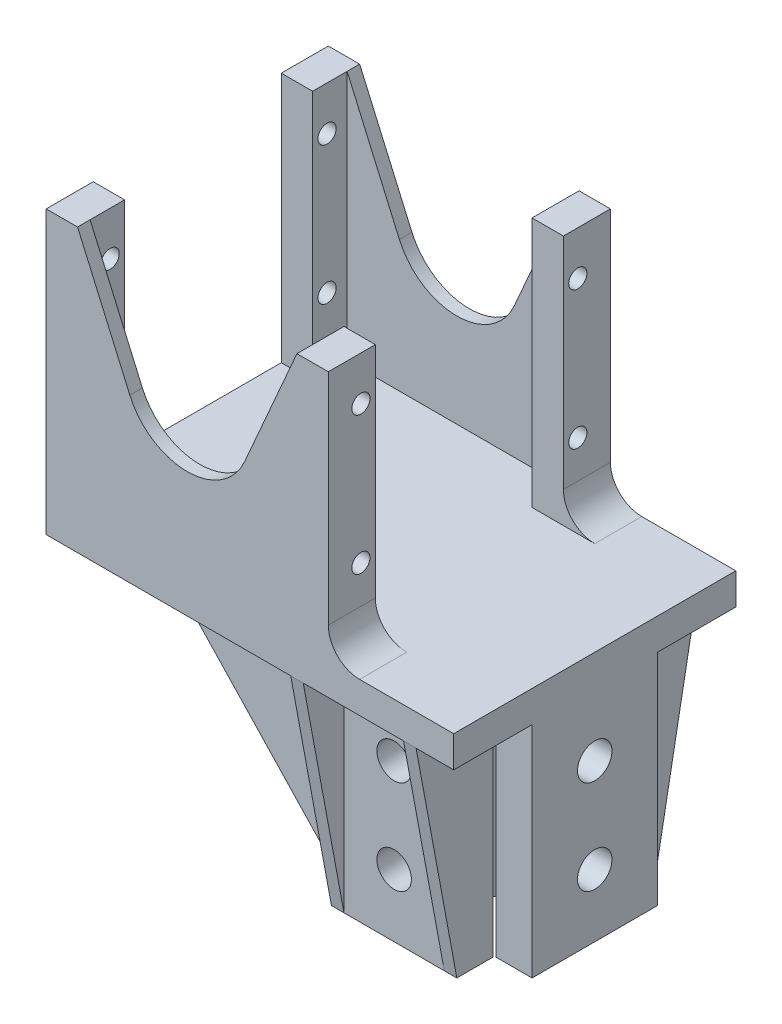
from build123d import *

# Parameters (mm, degrees)
BOSS_EXTRUDE1_DEPTH           = 45
SKETCH3_W                     = 30
SKETCH3_H                     = 40
CUT_EXTRUDE1_DEPTH            = 83.196411114
SKETCH4_W                     = 32
SKETCH4_H                     = 32
SKETCH4_W_2                   = 20.5
SKETCH4_H_2                   = 20.5
SKETCH4_R                     = 2.5
BOSS_EXTRUDE2_DEPTH           = 35
SKETCH6_W                     = 6
SKETCH6_H                     = 6
CUT_EXTRUDE4_DEPTH            = 35
RIB1_REACH                    = 84.092
SKETCH9_WALL_W                = 214.287640152
SKETCH9_WALL_H                = 2
LPATTERN1_COUNT               = 2
LPATTERN1_PITCH               = 18
RIB6_REACH                    = 95.874
SKETCH14_WALL_W               = 225.34562544
SKETCH14_WALL_H               = 2
RIB7_START                    = -2
RIB7_DEPTH                    = 2
CIRPATTERN3_START             = -9.75
CIRPATTERN3_DEPTH             = 2
CIRPATTERN3_START_2           = 8.25
CIRPATTERN3_2_DEPTH           = 2
FILLET2_R                     = 5
FILLET3_R                     = 5
RIB10_REACH                   = 89.794
SKETCH17_WALL_W               = 221.248919868
SKETCH17_WALL_H               = 2
RIB11_REACH                   = 89.794
SKETCH18_WALL_W               = 221.248919868
SKETCH18_WALL_H               = 2
FILLET4_R                     = 10
LPATTERN2_COUNT               = 2
LPATTERN2_PITCH               = 43
FILLET4_OF_LPATTERN2_R        = 10
M5_CLEARANCE_HOLE2_AT_2_COUNT = 2
M5_CLEARANCE_HOLE2_AT_2_PITCH = 15
CIRPATTERN4_START             = 6.5
CIRPATTERN4_OUTLINE_R         = 2.75
CIRPATTERN4_DEPTH             = 5.75
CIRPATTERN4_START_2           = -15.75
CIRPATTERN4_2_OUTLINE_R       = 2.75
CIRPATTERN4_2_DEPTH           = 5.75
CIRPATTERN4_START_3           = 10.5
CIRPATTERN4_3_OUTLINE_R       = 2.75
CIRPATTERN4_3_DEPTH           = 5.75
M2_5_CLEARANCE_HOLE1_D        = 2.9


# Read off the part's stored shape, not the designer's step: Rib7, CirPattern3, CirPattern4
with BuildPart() as part:
    # Sketch2 → Boss-Extrude1 (new body)
    with BuildSketch(Plane.XY):
        Polygon((-48.75, -22.5), (16.25, -22.5), (16.25, -17.5), (-3.75, -17.5), (-3.75, 22.5), (-8.75, 22.5), (-8.75, -17.5), (-43.75, -17.5), (-43.75, 22.5), (-48.75, 22.5), align=None)
    extrude(amount=BOSS_EXTRUDE1_DEPTH)

    # Sketch3 → Cut-Extrude1 (cut, through all)
    with BuildSketch(Plane(origin=(-48.75, 0, 0), x_dir=(0, 0, -1), z_dir=(1, 0, 0))):
        with Locations((-22.5, 2.5)):
            Rectangle(SKETCH3_W, SKETCH3_H)
    extrude(amount=CUT_EXTRUDE1_DEPTH, mode=Mode.SUBTRACT)

    # Sketch4 → Boss-Extrude2 (add)
    # profile 1 of 2: a face of its own
    with BuildSketch(Plane.XZ.offset(22.5)):
        with Locations((0.25, 22.5)):
            Rectangle(SKETCH4_W, SKETCH4_H)
        with Locations((0.25, 22.5)):
            Rectangle(SKETCH4_W_2, SKETCH4_H_2, mode=Mode.SUBTRACT)
    # profile 2 of 2: a face of its own
    with BuildSketch(Plane.XZ.offset(22.5)):
        with Locations(Location((0.25, 22.5, 0), (0, 0, 180))):
            Circle(SKETCH4_R)
    extrude(amount=BOSS_EXTRUDE2_DEPTH)

    # Sketch6 → Cut-Extrude4 (cut)
    with BuildSketch(Plane(origin=(0, -57.5, 0), x_dir=(-1, 0, 0), z_dir=(0, -1, 0))):
        with Locations((12.75, -35.5)):
            Rectangle(SKETCH6_W, SKETCH6_H)
        with Locations((-13.25, -35.5)):
            Rectangle(SKETCH6_W, SKETCH6_H)
        with Locations((-13.25, -9.5)):
            Rectangle(SKETCH6_W, SKETCH6_H)
        with Locations((12.75, -9.5)):
            Rectangle(SKETCH6_W, SKETCH6_H)
    extrude(amount=-CUT_EXTRUDE4_DEPTH, mode=Mode.SUBTRACT)

    # Sketch9 wall → Rib1 (add, up to next)
    with BuildSketch(Plane(origin=(-32.25, -40, 32.5), x_dir=(-0.686012868689, 0.727589406185, 0), z_dir=(-0.727589406185, -0.686012868689, 0)), mode=Mode.PRIVATE) as rib1_sk1:
        with Locations((0, 1)):
            Rectangle(SKETCH9_WALL_W, SKETCH9_WALL_H)
    rib1_tool1 = extrude(rib1_sk1.sketch, amount=-RIB1_REACH, mode=Mode.PRIVATE) - part.part
    rib1 = rib1_tool1.solids().sort_by_distance((-32.25, -40, 32.5))[0]
    add(rib1)

    # LPattern1: Rib1 ×2
    with Locations(*[(0, 0, -i * LPATTERN1_PITCH) for i in range(1, LPATTERN1_COUNT)]):
        add(rib1)

    # Sketch14 wall → Rib6 (add, up to next)
    with BuildSketch(Plane(origin=(10.25, -40, 3.25), x_dir=(0, 0.983188736076, -0.182592193843), z_dir=(0, 0.182592193843, 0.983188736076)), mode=Mode.PRIVATE) as rib6_sk1:
        with Locations((0, 1)):
            Rectangle(SKETCH14_WALL_W, SKETCH14_WALL_H)
    rib6_tool1 = extrude(rib6_sk1.sketch, amount=RIB6_REACH, mode=Mode.PRIVATE) - part.part
    add(rib6_tool1.solids().sort_by_distance((10.25, -40, 3.25))[0])

    # Rib7 outline → Rib7 (add)
    with BuildSketch(Plane.ZY.offset(9.75).offset(RIB7_START)):
        Polygon((0, -22.5), (6.5, -57.5), (6.5, -22.5), align=None)
    extrude(amount=RIB7_DEPTH)

    # CirPattern3 outline → CirPattern3 (add)
    with BuildSketch(Plane.YZ.offset(CIRPATTERN3_START)):
        Polygon((-22.5, 38.5), (-22.5, 45), (-57.5, 38.5), align=None)
    extrude(amount=CIRPATTERN3_DEPTH)

    # CirPattern3 2 outline → CirPattern3 2 (add)
    with BuildSketch(Plane.YZ.offset(CIRPATTERN3_START_2)):
        Polygon((-22.5, 38.5), (-22.5, 45), (-57.5, 38.5), align=None)
    extrude(amount=CIRPATTERN3_2_DEPTH)

    # Fillet2
    fillet2_edges = [part.edges().sort_by_distance(p)[0] for p in [
        (-15.75, -22.5, 22.5),
        (0.25, -22.5, 6.5),
        (0.25, -22.5, 38.5),
    ]]
    fillet(fillet2_edges, radius=FILLET2_R)

    # Fillet3
    fillet3_edges = [part.edges().sort_by_distance(p)[0] for p in [
        (-3.75, -17.5, 41.25),
        (-3.75, -17.5, 3.75),
    ]]
    fillet(fillet3_edges, radius=FILLET3_R)

    # Sketch17 wall → Rib10 (add, up to next)
    with BuildSketch(Plane(origin=(-35, 2.5, 45), x_dir=(0.40081883402, -0.916157334902, 0), z_dir=(0.916157334902, 0.40081883402, 0)), mode=Mode.PRIVATE) as rib10_sk1:
        with Locations((0, 1)):
            Rectangle(SKETCH17_WALL_W, SKETCH17_WALL_H)
    rib10_tool1 = extrude(rib10_sk1.sketch, amount=-RIB10_REACH, mode=Mode.PRIVATE) - part.part
    rib10 = rib10_tool1.solids().sort_by_distance((-35, 2.5, 45))[0]
    add(rib10)

    # Sketch18 wall → Rib11 (add, up to next)
    with BuildSketch(Plane(origin=(-17.5, 2.5, 45), x_dir=(0.40081883402, 0.916157334902, 0), z_dir=(-0.916157334902, 0.40081883402, 0)), mode=Mode.PRIVATE) as rib11_sk1:
        with Locations((0, 1)):
            Rectangle(SKETCH18_WALL_W, SKETCH18_WALL_H)
    rib11_tool1 = extrude(rib11_sk1.sketch, amount=-RIB11_REACH, mode=Mode.PRIVATE) - part.part
    rib11 = rib11_tool1.solids().sort_by_distance((-17.5, 2.5, 45))[0]
    add(rib11)

    # Fillet4
    # the kernel refuses this fillet: 10 mm, written as the material it adds along each edge
    with BuildSketch(Plane(origin=(-26.25, -17.5, 45), x_dir=(-0.4008188340200225, 0.9161573349020514, 0), z_dir=(0, 0, -1))) as fillet4_piece_1:
        with BuildLine():
            CenterArc((FILLET4_R * 2.28571428571, FILLET4_R), FILLET4_R, 137.258755461, 132.741244539)
            Line((FILLET4_R * 1.55128805621, FILLET4_R * 1.67868852459), (0, 0))
            Line((0, 0), (FILLET4_R * 2.28571428571, 0))
        make_face()
    extrude(amount=2)

    # LPattern2: Rib10, Rib11 ×2
    with Locations(*[(0, 0, -i * LPATTERN2_PITCH) for i in range(1, LPATTERN2_COUNT)]):
        add(rib10)
        add(rib11)

    # Fillet4 of LPattern2
    # the kernel refuses this fillet: 10 mm, written as the material it adds along each edge
    with BuildSketch(Plane(origin=(-26.25, -17.5, 59.142857143), x_dir=(-0.4008188340200225, 0.9161573349020515, 0), z_dir=(0, 0, -1))) as fillet4_of_lpattern2_piece_1_section:
        with BuildLine():
            CenterArc((FILLET4_OF_LPATTERN2_R * 2.28571428571, FILLET4_OF_LPATTERN2_R), FILLET4_OF_LPATTERN2_R, 137.258755461, 132.741244539)
            Line((FILLET4_OF_LPATTERN2_R * 1.5512880562, FILLET4_OF_LPATTERN2_R * 1.67868852459), (0, 0))
            Line((0, 0), (FILLET4_OF_LPATTERN2_R * 2.28571428571, 0))
        make_face()
    fillet4_of_lpattern2_piece_1 = extrude(amount=59.142857143, mode=Mode.PRIVATE)
    fillet4_of_lpattern2_piece_1 = split(fillet4_of_lpattern2_piece_1, bisect_by=Plane(origin=(-26.25, -6.732617491, 43), z_dir=(0, 0, 1)), keep=Keep.TOP, mode=Mode.PRIVATE)
    fillet4_of_lpattern2_piece_1 = split(fillet4_of_lpattern2_piece_1, bisect_by=Plane(origin=(-26.25, -6.732617491, 45), z_dir=(0, 0, -1)), keep=Keep.TOP, mode=Mode.PRIVATE)
    add(fillet4_of_lpattern2_piece_1)
    with BuildSketch(Plane(origin=(-26.25, -17.5, 2), x_dir=(-0.4008188340200225, 0.9161573349020514, 0), z_dir=(0, 0, -1))) as fillet4_of_lpattern2_piece_2:
        with BuildLine():
            CenterArc((FILLET4_OF_LPATTERN2_R * 2.28571428571, FILLET4_OF_LPATTERN2_R), FILLET4_OF_LPATTERN2_R, 137.258755461, 132.741244539)
            Line((FILLET4_OF_LPATTERN2_R * 1.55128805621, FILLET4_OF_LPATTERN2_R * 1.67868852459), (0, 0))
            Line((0, 0), (FILLET4_OF_LPATTERN2_R * 2.28571428571, 0))
        make_face()
    extrude(amount=2)

    # Sketch22 → M5 Clearance Hole2 (revolve, cut)
    with BuildSketch(Plane(origin=(0.25, -32.5, 38.5), x_dir=(0, -1, 0), z_dir=(1, 0, 0))):
        Polygon((0, 0), (0, 7.652366702), (2.75, 6), (2.75, 0), align=None)
    m5_clearance_hole2 = revolve(axis=Axis((0.25, -32.5, 44.85), (0, 0, -1)), mode=Mode.SUBTRACT)

    # M5 Clearance Hole2 at 2: M5 Clearance Hole2 ×2
    with Locations(*[(0, -i * M5_CLEARANCE_HOLE2_AT_2_PITCH, 0) for i in range(1, M5_CLEARANCE_HOLE2_AT_2_COUNT)]):
        add(m5_clearance_hole2, mode=Mode.SUBTRACT)

    # CirPattern4 outline → CirPattern4 (cut)
    with BuildSketch(Plane.XY.offset(CIRPATTERN4_START)):
        with Locations((0.25, -47.5)):
            Circle(CIRPATTERN4_OUTLINE_R)
        with Locations((0.25, -32.5)):
            Circle(CIRPATTERN4_OUTLINE_R)
    extrude(amount=CIRPATTERN4_DEPTH, mode=Mode.SUBTRACT)

    # CirPattern4 2 outline → CirPattern4 2 (cut)
    with BuildSketch(Plane.YZ.offset(CIRPATTERN4_START_2)):
        with Locations((-47.5, 22.5)):
            Circle(CIRPATTERN4_2_OUTLINE_R)
        with Locations((-32.5, 22.5)):
            Circle(CIRPATTERN4_2_OUTLINE_R)
    extrude(amount=CIRPATTERN4_2_DEPTH, mode=Mode.SUBTRACT)

    # CirPattern4 3 outline → CirPattern4 3 (cut)
    with BuildSketch(Plane.YZ.offset(CIRPATTERN4_START_3)):
        with Locations((-47.5, 22.5)):
            Circle(CIRPATTERN4_3_OUTLINE_R)
        with Locations((-32.5, 22.5)):
            Circle(CIRPATTERN4_3_OUTLINE_R)
    extrude(amount=CIRPATTERN4_3_DEPTH, mode=Mode.SUBTRACT)

    # M2.5 Clearance Hole1 (through all)
    with Locations(Plane.ZY.offset(48.75)):
        with Locations((5.2, 15.5), (39.8, 15.5), (39.8, -6.5), (5.2, -6.5)):
            Hole(M2_5_CLEARANCE_HOLE1_D / 2)


solid = part.part
